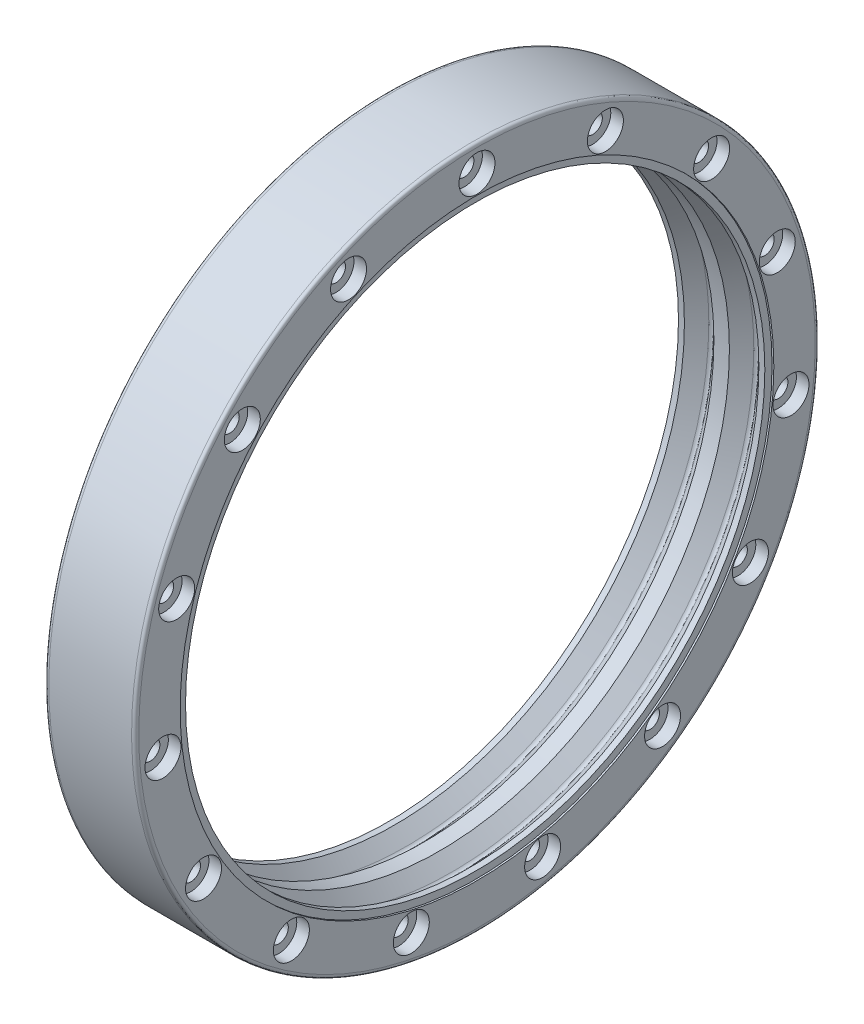
from build123d import *

# Parameters (mm, degrees)
CUT_EXTRUDE1_START = -0.5
SKETCH2_R          = 82.5
SKETCH2_R_2        = 80.5
CUT_EXTRUDE1_DEPTH = 0.5
FILLET1_SIZE       = 1
FILLET2_SIZE       = 1
CIRPATTERN1_COUNT  = 15


with BuildPart() as part:
    # Revolve1: read off the stored shape, not the designer's step
    # Revolve1 outline → Revolve1 (revolve)
    with BuildSketch(Plane.YX):
        Polygon((84.596194078, 6.25), (80.5, 2.153805922), (80.5, -2.153805922), (84.596194078, -6.25), (80.5, -10.346194078), (80.5, -12.5), (95, -12.5), (95, 12.5), (80.5, 12.5), (80.5, 10.346194078), align=None)
    revolve(axis=Axis((0, 0, 0), (1, 0, 0)))

    # Sketch2 → Cut-Extrude1 (cut)
    with BuildSketch(Plane(origin=(12.5, 0, 0), x_dir=(0, 0, -1), z_dir=(1, 0, 0)).offset(CUT_EXTRUDE1_START)):
        Circle(SKETCH2_R)
        Circle(SKETCH2_R_2, mode=Mode.SUBTRACT)
    cut_extrude1 = extrude(amount=CUT_EXTRUDE1_DEPTH, mode=Mode.SUBTRACT)

    # Mirror1: Cut-Extrude1 across plane
    add(cut_extrude1.mirror(Plane(origin=(0, 0, 0), x_dir=(0, 0, 1), z_dir=(1, 0, 0))), mode=Mode.SUBTRACT)

    # Fillet1
    # a fillet whose section is not a circle: 1 mm, written as the material it takes off along each edge
    with BuildSketch(Plane(origin=(-12.5, 0, 0), x_dir=(0, 1, 0), z_dir=(0, 0, -1))) as fillet1_piece_1:
        with BuildLine():
            add(Edge.make_bspline([(95 - FILLET1_SIZE, 0), (95 - FILLET1_SIZE * 0.831801948466, 0), (95 - FILLET1_SIZE * 0.663603896932, 0), (95 - FILLET1_SIZE * 0.292893218813, FILLET1_SIZE * 0.0716919198361), (95 - FILLET1_SIZE * 0.0716919198361, FILLET1_SIZE * 0.292893218813), (95, FILLET1_SIZE * 0.663603896932), (95, FILLET1_SIZE * 0.831801948466), (95, FILLET1_SIZE)], knots=[0, 0, 0, 0, 0, 0, 0.5, 0.5, 1, 1, 1, 1, 1, 1], degree=5))
            Line((95, FILLET1_SIZE), (95 + FILLET1_SIZE * 0.02, FILLET1_SIZE))
            Line((95 + FILLET1_SIZE * 0.02, FILLET1_SIZE), (95 + FILLET1_SIZE * 0.02, -FILLET1_SIZE * 0.02))
            Line((95 + FILLET1_SIZE * 0.02, -FILLET1_SIZE * 0.02), (95 - FILLET1_SIZE, -FILLET1_SIZE * 0.02))
            Line((95 - FILLET1_SIZE, -FILLET1_SIZE * 0.02), (95 - FILLET1_SIZE, 0))
        make_face()
    revolve(axis=Axis((-12.5, 0, 0), (1, 0, 0)), mode=Mode.SUBTRACT)
    with BuildSketch(Plane(origin=(12.5, 0, 0), x_dir=(0, 1, 0), z_dir=(0, 0, -1))) as fillet1_piece_2:
        with BuildLine():
            add(Edge.make_bspline([(95, -FILLET1_SIZE), (95, -FILLET1_SIZE * 0.831801948466), (95, -FILLET1_SIZE * 0.663603896932), (95 - FILLET1_SIZE * 0.0716919198361, -FILLET1_SIZE * 0.292893218813), (95 - FILLET1_SIZE * 0.292893218813, -FILLET1_SIZE * 0.0716919198361), (95 - FILLET1_SIZE * 0.663603896932, 0), (95 - FILLET1_SIZE * 0.831801948466, 0), (95 - FILLET1_SIZE, 0)], knots=[0, 0, 0, 0, 0, 0, 0.5, 0.5, 1, 1, 1, 1, 1, 1], degree=5))
            Line((95 - FILLET1_SIZE, 0), (95 - FILLET1_SIZE, FILLET1_SIZE * 0.02))
            Line((95 - FILLET1_SIZE, FILLET1_SIZE * 0.02), (95 + FILLET1_SIZE * 0.02, FILLET1_SIZE * 0.02))
            Line((95 + FILLET1_SIZE * 0.02, FILLET1_SIZE * 0.02), (95 + FILLET1_SIZE * 0.02, -FILLET1_SIZE))
            Line((95 + FILLET1_SIZE * 0.02, -FILLET1_SIZE), (95, -FILLET1_SIZE))
        make_face()
    revolve(axis=Axis((12.5, 0, 0), (1, 0, 0)), mode=Mode.SUBTRACT)

    # Fillet2
    # a fillet whose section is not a circle: 1 mm, written as the material it adds along each edge
    with BuildSketch(Plane(origin=(6.25, 0, 0), x_dir=(0, 1, 0), z_dir=(0, 0, -1))) as fillet2_piece_1:
        with BuildLine():
            add(Edge.make_bspline([(84.596194078 - FILLET2_SIZE * 0.707106781187, -FILLET2_SIZE * 0.707106781187), (84.596194078 - FILLET2_SIZE * 0.588172798365, -FILLET2_SIZE * 0.588172798365), (84.596194078 - FILLET2_SIZE * 0.469238815543, -FILLET2_SIZE * 0.469238815543), (84.596194078 - FILLET2_SIZE * 0.257800623859, -FILLET2_SIZE * 0.156412938514), (84.596194078 - FILLET2_SIZE * 0.257800623859, FILLET2_SIZE * 0.156412938514), (84.596194078 - FILLET2_SIZE * 0.469238815543, FILLET2_SIZE * 0.469238815543), (84.596194078 - FILLET2_SIZE * 0.588172798365, FILLET2_SIZE * 0.588172798365), (84.596194078 - FILLET2_SIZE * 0.707106781187, FILLET2_SIZE * 0.707106781187)], knots=[0, 0, 0, 0, 0, 0, 0.5, 0.5, 1, 1, 1, 1, 1, 1], degree=5))
            Line((84.596194078 - FILLET2_SIZE * 0.707106781187, FILLET2_SIZE * 0.707106781187), (84.596194078 - FILLET2_SIZE * 0.692964645563, FILLET2_SIZE * 0.72124891681))
            Line((84.596194078 - FILLET2_SIZE * 0.692964645563, FILLET2_SIZE * 0.72124891681), (84.596194078 + FILLET2_SIZE * 0.0282842712475, 0))
            Line((84.596194078 + FILLET2_SIZE * 0.0282842712475, 0), (84.596194078 - FILLET2_SIZE * 0.692964645563, -FILLET2_SIZE * 0.72124891681))
            Line((84.596194078 - FILLET2_SIZE * 0.692964645563, -FILLET2_SIZE * 0.72124891681), (84.596194078 - FILLET2_SIZE * 0.707106781187, -FILLET2_SIZE * 0.707106781187))
        make_face()
    revolve(axis=Axis((6.25, 0, 0), (1, 0, 0)))
    with BuildSketch(Plane(origin=(-6.25, 0, 0), x_dir=(0, 1, 0), z_dir=(0, 0, -1))) as fillet2_piece_2:
        with BuildLine():
            add(Edge.make_bspline([(84.596194078 - FILLET2_SIZE * 0.707106781187, FILLET2_SIZE * 0.707106781187), (84.596194078 - FILLET2_SIZE * 0.588172798365, FILLET2_SIZE * 0.588172798365), (84.596194078 - FILLET2_SIZE * 0.469238815543, FILLET2_SIZE * 0.469238815543), (84.596194078 - FILLET2_SIZE * 0.257800623859, FILLET2_SIZE * 0.156412938514), (84.596194078 - FILLET2_SIZE * 0.257800623859, -FILLET2_SIZE * 0.156412938514), (84.596194078 - FILLET2_SIZE * 0.469238815543, -FILLET2_SIZE * 0.469238815543), (84.596194078 - FILLET2_SIZE * 0.588172798365, -FILLET2_SIZE * 0.588172798365), (84.596194078 - FILLET2_SIZE * 0.707106781187, -FILLET2_SIZE * 0.707106781187)], knots=[0, 0, 0, 0, 0, 0, 0.5, 0.5, 1, 1, 1, 1, 1, 1], degree=5))
            Line((84.596194078 - FILLET2_SIZE * 0.707106781187, -FILLET2_SIZE * 0.707106781187), (84.596194078 - FILLET2_SIZE * 0.692964645563, -FILLET2_SIZE * 0.72124891681))
            Line((84.596194078 - FILLET2_SIZE * 0.692964645563, -FILLET2_SIZE * 0.72124891681), (84.596194078 + FILLET2_SIZE * 0.0282842712475, 0))
            Line((84.596194078 + FILLET2_SIZE * 0.0282842712475, 0), (84.596194078 - FILLET2_SIZE * 0.692964645563, FILLET2_SIZE * 0.72124891681))
            Line((84.596194078 - FILLET2_SIZE * 0.692964645563, FILLET2_SIZE * 0.72124891681), (84.596194078 - FILLET2_SIZE * 0.707106781187, FILLET2_SIZE * 0.707106781187))
        make_face()
    revolve(axis=Axis((-6.25, 0, 0), (1, 0, 0)))

    # Sketch4 → CBORE for M5 Hex Head Cap Screw1 (revolve, cut)
    with BuildSketch(Plane(origin=(12.5, 87.75, 0), x_dir=(0, 0, -1), z_dir=(0, 1, 0))):
        Polygon((0, 0), (0, 31.59228064), (2.65, 30), (2.65, 3.5), (5, 3.5), (5, 0), align=None)
    cbore_for_m5_hex_head_cap_screw1 = revolve(axis=Axis((18.85, 87.75, 0), (-1, 0, 0)), mode=Mode.SUBTRACT)

    # CirPattern1: CBORE for M5 Hex Head Cap Screw1 ×15 about axis
    cirpattern1_axis = Axis((0, 0, 0), (1, 0, 0))
    for i in range(1, CIRPATTERN1_COUNT):
        add(cbore_for_m5_hex_head_cap_screw1.rotate(cirpattern1_axis, i * 360 / CIRPATTERN1_COUNT), mode=Mode.SUBTRACT)


solid = part.part
